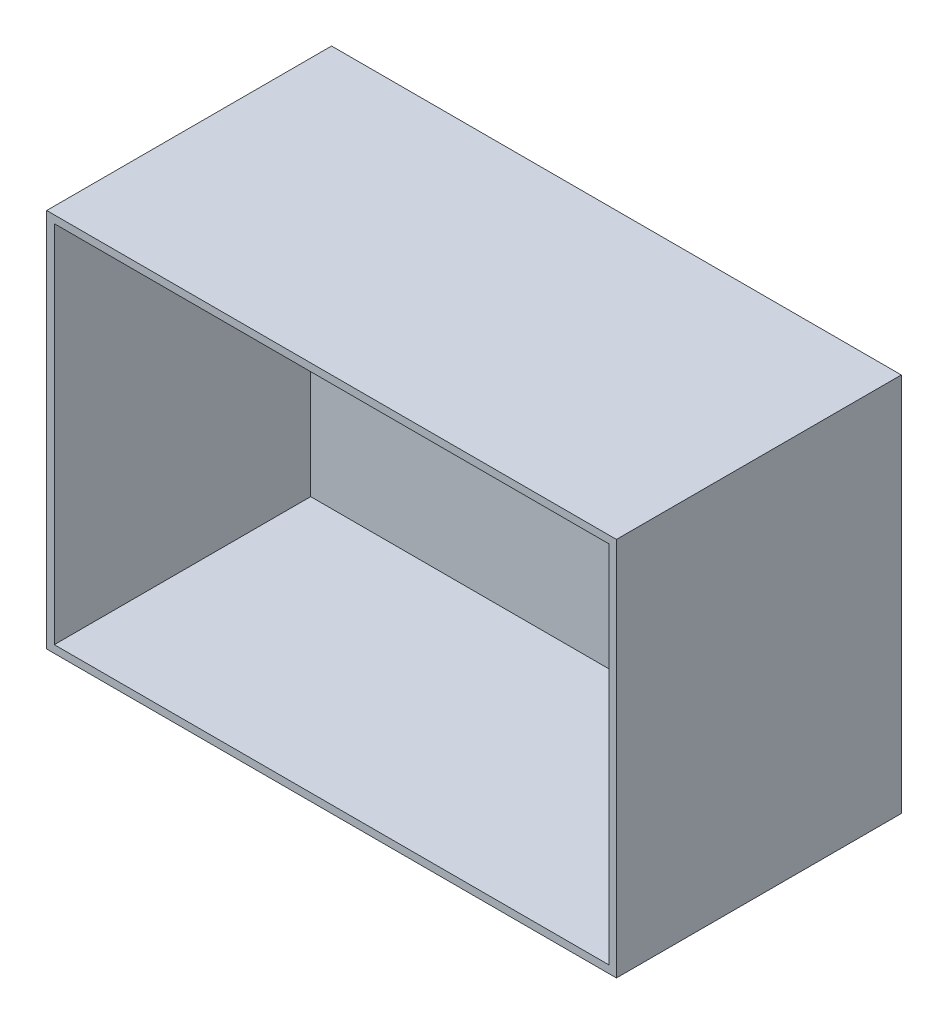
from build123d import *

# Parameters (mm, degrees)
ESQUISSE1_W             = 150
ESQUISSE1_H             = 100
BOSS_EXTRU_2_DEPTH      = 75
ESQUISSE4_W             = 146
ESQUISSE4_H             = 96
ENL_V_MAT_EXTRU_1_DEPTH = 67.5


with BuildPart() as part:
    # Esquisse1 → Boss.-Extru.2 (new body)
    with BuildSketch(Plane.XY):
        with Locations((35.412819636, -28.694817658)):
            Rectangle(ESQUISSE1_W, ESQUISSE1_H)
    extrude(amount=BOSS_EXTRU_2_DEPTH)

    # Esquisse4 → Enlèv. mat.-Extru.1 (cut)
    with BuildSketch(Plane.XY.offset(75)):
        with Locations((35.412819636, -28.694817658)):
            Rectangle(ESQUISSE4_W, ESQUISSE4_H)
    extrude(amount=-ENL_V_MAT_EXTRU_1_DEPTH, mode=Mode.SUBTRACT)


solid = part.part
